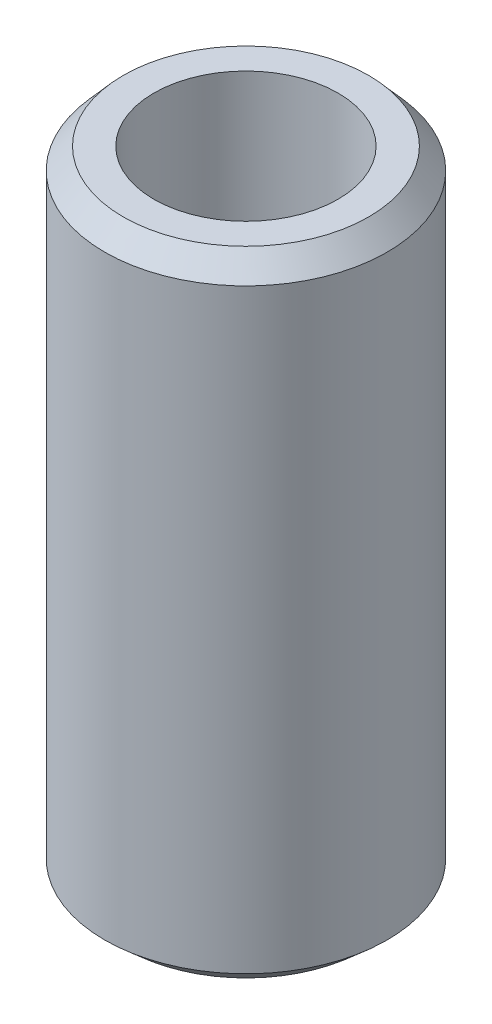
from build123d import *
from OCP.BRepFilletAPI import BRepFilletAPI_MakeChamfer

# Parameters (mm, degrees)
SKETCH1_R           = 40
BOSS_EXTRUDE1_DEPTH = 179.936409287
SKETCH2_R           = 26.0681676
CUT_EXTRUDE1_DEPTH  = 189.618958185
CHAMFER1_SIZE       = 5.99180318
CHAMFER1_SIZE2      = 5.266463177


with BuildPart() as part:
    # Sketch1 → Boss-Extrude1 (new body)
    with BuildSketch(Plane(origin=(0, 0, 0), x_dir=(1, 0, 0), z_dir=(0, 1, 0))):
        Circle(SKETCH1_R)
    extrude(amount=BOSS_EXTRUDE1_DEPTH)

    # Sketch2 → Cut-Extrude1 (cut, through all)
    with BuildSketch(Plane(origin=(0, 0, 0), x_dir=(1, 0, 0), z_dir=(0, 1, 0))):
        Circle(SKETCH2_R)
    extrude(amount=CUT_EXTRUDE1_DEPTH, mode=Mode.SUBTRACT)

    # Chamfer1: one chamfer whose edges measure the first distance from different faces: ONE call of the kernel's chamfer builder (chamfer() names one face for all edges)
    chamfer1_edges_1 = [part.edges().sort_by_distance(p)[0] for p in [
        (-40, 179.936409287, 0),
    ]]
    chamfer1_side_1 = [part.faces().sort_by_distance(p)[0] for p in [
        (-40, 89.968204643, 0),
    ]]
    chamfer1_edges_2 = [part.edges().sort_by_distance(p)[0] for p in [
        (-40, 0, 0),
    ]]
    chamfer1_side_2 = [part.faces().sort_by_distance(p)[0] for p in [
        (-38.86862915, 0, 0),
    ]]
    chamfer1 = BRepFilletAPI_MakeChamfer(part.part.solid().wrapped)
    for e in chamfer1_edges_1:
        chamfer1.Add(CHAMFER1_SIZE, CHAMFER1_SIZE2, e.wrapped, chamfer1_side_1[0].wrapped)  # the first distance lies on this face
    for e in chamfer1_edges_2:
        chamfer1.Add(CHAMFER1_SIZE, CHAMFER1_SIZE2, e.wrapped, chamfer1_side_2[0].wrapped)  # the first distance lies on this face
    add(Compound.cast(chamfer1.Shape()), mode=Mode.REPLACE)


solid = part.part
